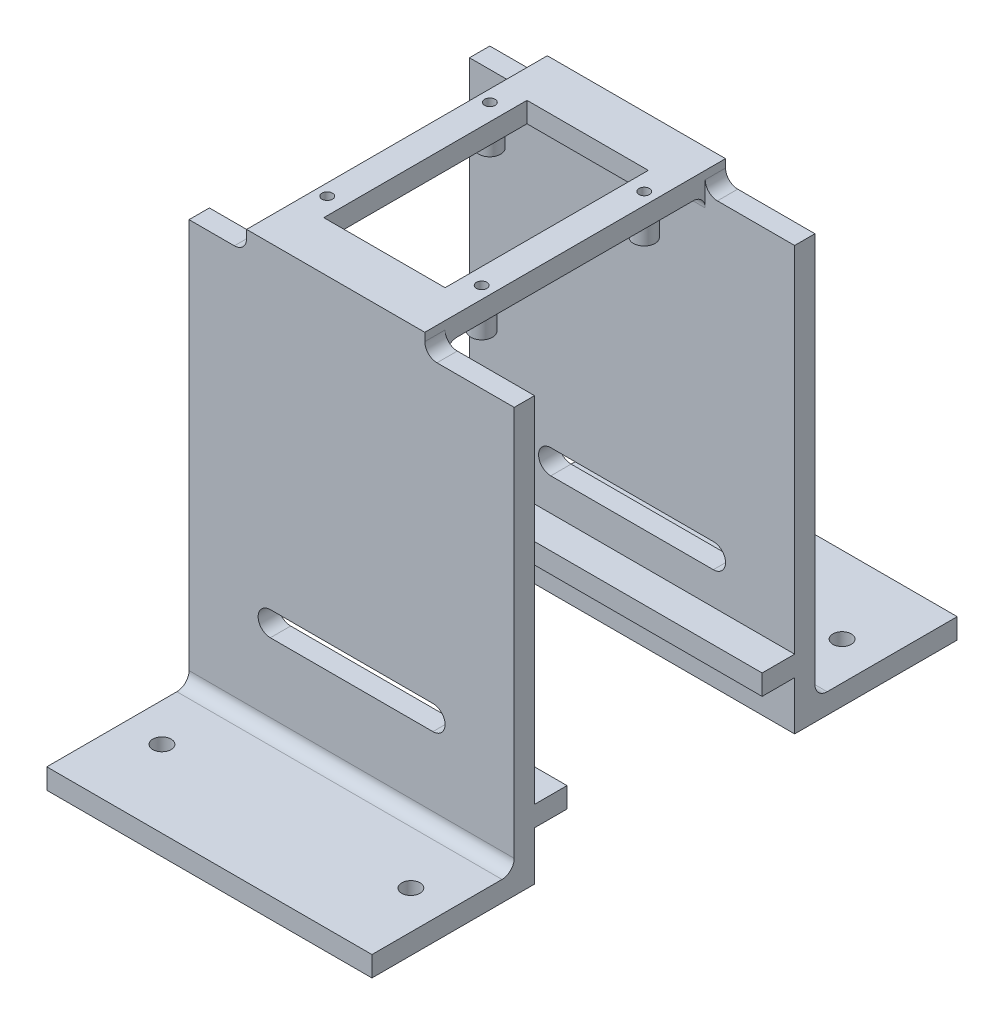
from build123d import *

# Parameters (mm, degrees)
SKETCH1_W             = 80
SKETCH1_H             = 40
SKETCH1_R             = 2.25
BOSS_EXTRUDE1_DEPTH   = 5
BOSS_EXTRUDE1_2_DEPTH = 5
SKETCH2_W             = 80
SKETCH2_H             = 5
BOSS_EXTRUDE2_DEPTH   = 99.09
SKETCH3_W             = 43.85
SKETCH3_H             = 74
BOSS_EXTRUDE3_DEPTH   = 5
SKETCH5_W             = 29.85
SKETCH5_H             = 50
CUT_EXTRUDE2_DEPTH    = 10
CUT_EXTRUDE1_REACH    = 138.692
SKETCH4_R             = 1.3
FILLET1_R             = 3
FILLET2_R             = 3
SKETCH9_R             = 2.65
SKETCH9_R_2           = 1.05
BOSS_EXTRUDE5_DEPTH   = 4.75
SKETCH10_W            = 12
SKETCH10_H            = 6.8
CUT_EXTRUDE4_DEPTH    = 8
SKETCH11_W            = 80
SKETCH11_H            = 5
BOSS_EXTRUDE6_DEPTH   = 8
CUT_EXTRUDE5_REACH    = 161.316


with BuildPart() as part:
    # Sketch1 → Boss-Extrude1 (new body)
    with BuildSketch(Plane(origin=(0, 0, 0), x_dir=(1, 0, 0), z_dir=(0, 1, 0))):
        with Locations((0, 52)):
            Rectangle(SKETCH1_W, SKETCH1_H)
        with Locations((-30.625, 53.044055982)):
            Circle(SKETCH1_R, mode=Mode.SUBTRACT)
        with Locations((30.625, 53.044055982)):
            Circle(SKETCH1_R, mode=Mode.SUBTRACT)
    extrude(amount=BOSS_EXTRUDE1_DEPTH)



with BuildPart() as body_2:
    # Sketch1 → Boss-Extrude1 2 (new body)
    with BuildSketch(Plane(origin=(0, 0, 0), x_dir=(1, 0, 0), z_dir=(0, 1, 0))):
        with Locations((0, -52)):
            Rectangle(SKETCH1_W, SKETCH1_H)
        with Locations((30.625, -53.044055982)):
            Circle(SKETCH1_R, mode=Mode.SUBTRACT)
        with Locations((-30.625, -53.044055982)):
            Circle(SKETCH1_R, mode=Mode.SUBTRACT)
    extrude(amount=BOSS_EXTRUDE1_2_DEPTH)


with BuildPart() as part_1:
    add(part.part)

    add(body_2.part)  # Boss-Extrude2 merges body 2
    # Sketch2 → Boss-Extrude2 (add)
    with BuildSketch(Plane(origin=(0, 5, 0), x_dir=(1, 0, 0), z_dir=(0, 1, 0))):
        with Locations((0, 34.5)):
            Rectangle(SKETCH2_W, SKETCH2_H)
        with Locations((0, -34.5)):
            Rectangle(SKETCH2_W, SKETCH2_H)
    extrude(amount=BOSS_EXTRUDE2_DEPTH)

    # Sketch3 → Boss-Extrude3 (add)
    with BuildSketch(Plane(origin=(0, 104.09, 0), x_dir=(1, 0, 0), z_dir=(0, 1, 0))):
        with Locations((-3.925, 0)):
            Rectangle(SKETCH3_W, SKETCH3_H)
    extrude(amount=BOSS_EXTRUDE3_DEPTH)

    # Sketch5 → Cut-Extrude2 (cut)
    with BuildSketch(Plane.XZ.offset(-104.09)):
        with Locations((-3.925, 0)):
            Rectangle(SKETCH5_W, SKETCH5_H)
    extrude(amount=-CUT_EXTRUDE2_DEPTH, mode=Mode.SUBTRACT)

    # Sketch4 → Cut-Extrude1 (cut, up to next)
    with BuildSketch(Plane(origin=(0, 109.09, 0), x_dir=(1, 0, 0), z_dir=(0, 1, 0)), mode=Mode.PRIVATE) as cut_extrude1_sk1:
        with Locations((-23, 20)):
            Circle(SKETCH4_R)
    cut_extrude1_tool1 = extrude(cut_extrude1_sk1.sketch, amount=-CUT_EXTRUDE1_REACH, mode=Mode.PRIVATE) & part_1.part
    # Sketch4 → Cut-Extrude1 (cut, up to next)
    with BuildSketch(Plane(origin=(0, 109.09, 0), x_dir=(1, 0, 0), z_dir=(0, 1, 0)), mode=Mode.PRIVATE) as cut_extrude1_sk2:
        with Locations((15, 20)):
            Circle(SKETCH4_R)
    cut_extrude1_tool2 = extrude(cut_extrude1_sk2.sketch, amount=-CUT_EXTRUDE1_REACH, mode=Mode.PRIVATE) & part_1.part
    # Sketch4 → Cut-Extrude1 (cut, up to next)
    with BuildSketch(Plane(origin=(0, 109.09, 0), x_dir=(1, 0, 0), z_dir=(0, 1, 0)), mode=Mode.PRIVATE) as cut_extrude1_sk3:
        with Locations((15, -20)):
            Circle(SKETCH4_R)
    cut_extrude1_tool3 = extrude(cut_extrude1_sk3.sketch, amount=-CUT_EXTRUDE1_REACH, mode=Mode.PRIVATE) & part_1.part
    # Sketch4 → Cut-Extrude1 (cut, up to next)
    with BuildSketch(Plane(origin=(0, 109.09, 0), x_dir=(1, 0, 0), z_dir=(0, 1, 0)), mode=Mode.PRIVATE) as cut_extrude1_sk4:
        with Locations((-23, -20)):
            Circle(SKETCH4_R)
    cut_extrude1_tool4 = extrude(cut_extrude1_sk4.sketch, amount=-CUT_EXTRUDE1_REACH, mode=Mode.PRIVATE) & part_1.part
    add(cut_extrude1_tool1.solids().sort_by_distance((-23, 109.09, -20))[0], mode=Mode.SUBTRACT)
    add(cut_extrude1_tool2.solids().sort_by_distance((15, 109.09, -20))[0], mode=Mode.SUBTRACT)
    add(cut_extrude1_tool3.solids().sort_by_distance((15, 109.09, 20))[0], mode=Mode.SUBTRACT)
    add(cut_extrude1_tool4.solids().sort_by_distance((-23, 109.09, 20))[0], mode=Mode.SUBTRACT)

    # Fillet1
    fillet1_edges = [part_1.edges().sort_by_distance(p)[0] for p in [
        (-3.925, 104.09, -32),
        (-3.925, 104.09, 32),
        (0, 5, -37),
        (0, 5, 37),
    ]]
    fillet(fillet1_edges, radius=FILLET1_R)

    # Fillet2
    fillet2_edges = [part_1.edges().sort_by_distance(p)[0] for p in [
        (18, 104.09, -34.5),
        (-25.85, 104.09, -34.5),
        (-25.85, 104.09, 34.5),
        (18, 104.09, 34.5),
    ]]
    fillet(fillet2_edges, radius=FILLET2_R)

    # Sketch9 → Boss-Extrude5 (add)
    # profile 1 of 4: a face of its own
    with BuildSketch(Plane.XZ.offset(-104.09)):
        with Locations((-23, 20)):
            Circle(SKETCH9_R)
        with Locations((-23, 20)):
            Circle(SKETCH9_R_2, mode=Mode.SUBTRACT)
    # profile 2 of 4: a face of its own
    with BuildSketch(Plane.XZ.offset(-104.09)):
        with Locations((-23, -20)):
            Circle(SKETCH9_R)
        with Locations((-23, -20)):
            Circle(SKETCH9_R_2, mode=Mode.SUBTRACT)
    # profile 3 of 4: a face of its own
    with BuildSketch(Plane.XZ.offset(-104.09)):
        with Locations((15, 20)):
            Circle(SKETCH9_R)
        with Locations((15, 20)):
            Circle(SKETCH9_R_2, mode=Mode.SUBTRACT)
    # profile 4 of 4: a face of its own
    with BuildSketch(Plane.XZ.offset(-104.09)):
        with Locations((15, -20)):
            Circle(SKETCH9_R)
        with Locations((15, -20)):
            Circle(SKETCH9_R_2, mode=Mode.SUBTRACT)
    extrude(amount=BOSS_EXTRUDE5_DEPTH)

    # Sketch10 → Cut-Extrude4 (cut)
    with BuildSketch(Plane.XY.offset(37)):
        with Locations((6.7, 101.24)):
            Rectangle(SKETCH10_W, SKETCH10_H)
    extrude(amount=-CUT_EXTRUDE4_DEPTH, mode=Mode.SUBTRACT)

    # Sketch11 → Boss-Extrude6 (add)
    with BuildSketch(Plane(origin=(0, 0, 32), x_dir=(-1, 0, 0), z_dir=(0, 0, -1))):
        with Locations((0, 14.5)):
            Rectangle(SKETCH11_W, SKETCH11_H)
    extrude(amount=BOSS_EXTRUDE6_DEPTH)

    # Mirror3: part across plane


with BuildPart() as part_2:
    add(part_1.part)
    add(part_1.part.mirror(Plane.XY))

    # Sketch12 → Cut-Extrude5 (cut, up to next)
    with BuildSketch(Plane(origin=(0, 0, -37), x_dir=(-1, 0, 0), z_dir=(0, 0, -1)), mode=Mode.PRIVATE) as cut_extrude5_sk1:
        with BuildLine():
            Line((20, 25), (-20, 25))
            ThreePointArc((-20, 25), (-23, 28), (-20, 31))
            Line((-20, 31), (20, 31))
            ThreePointArc((20, 31), (23, 28), (20, 25))
        make_face()
    cut_extrude5_tool1 = extrude(cut_extrude5_sk1.sketch, amount=-CUT_EXTRUDE5_REACH, mode=Mode.PRIVATE) & part_2.part
    cut_extrude5 = cut_extrude5_tool1.solids().sort_by_distance((0, 28, -37))[0]
    add(cut_extrude5, mode=Mode.SUBTRACT)

    # Mirror4: Cut-Extrude5 across plane
    add(cut_extrude5.mirror(Plane.XY), mode=Mode.SUBTRACT)


solid = part_2.part
